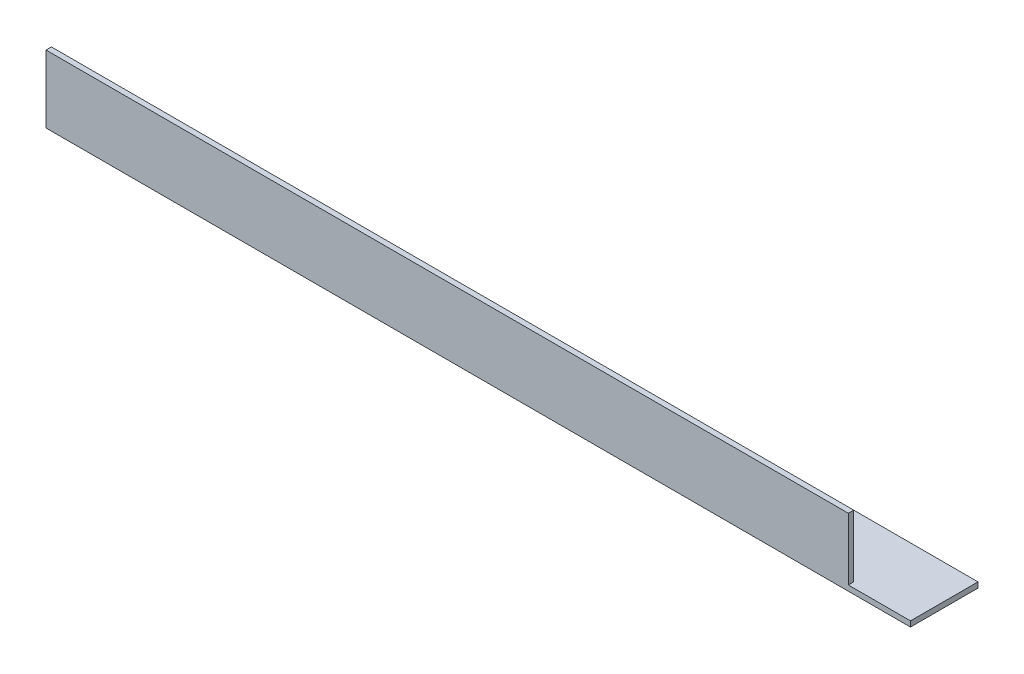
from build123d import *

# Parameters (mm, degrees)
EXTRUDE_1_DEPTH     = 320
SKETCH_3_W          = 23
SKETCH_3_H          = 23
CUT_EXTRUDE_1_DEPTH = 322.94720064


with BuildPart() as part:
    # Эскиз1 → Вытянуть-Тонкостенный1 (new body)
    with BuildSketch(Plane(origin=(0, 0, 0), x_dir=(0, 0, -1), z_dir=(1, 0, 0))):
        Polygon((0, 25), (0, 0), (25, 0), (25, 2), (2, 2), (2, 25), align=None)
    extrude(amount=EXTRUDE_1_DEPTH)

    # Эскиз3 → Вырез-Вытянуть1 (cut, through all)
    with BuildSketch(Plane.XY):
        with Locations((308.5, 13.5)):
            Rectangle(SKETCH_3_W, SKETCH_3_H)
    extrude(amount=-CUT_EXTRUDE_1_DEPTH, mode=Mode.SUBTRACT)


solid = part.part
